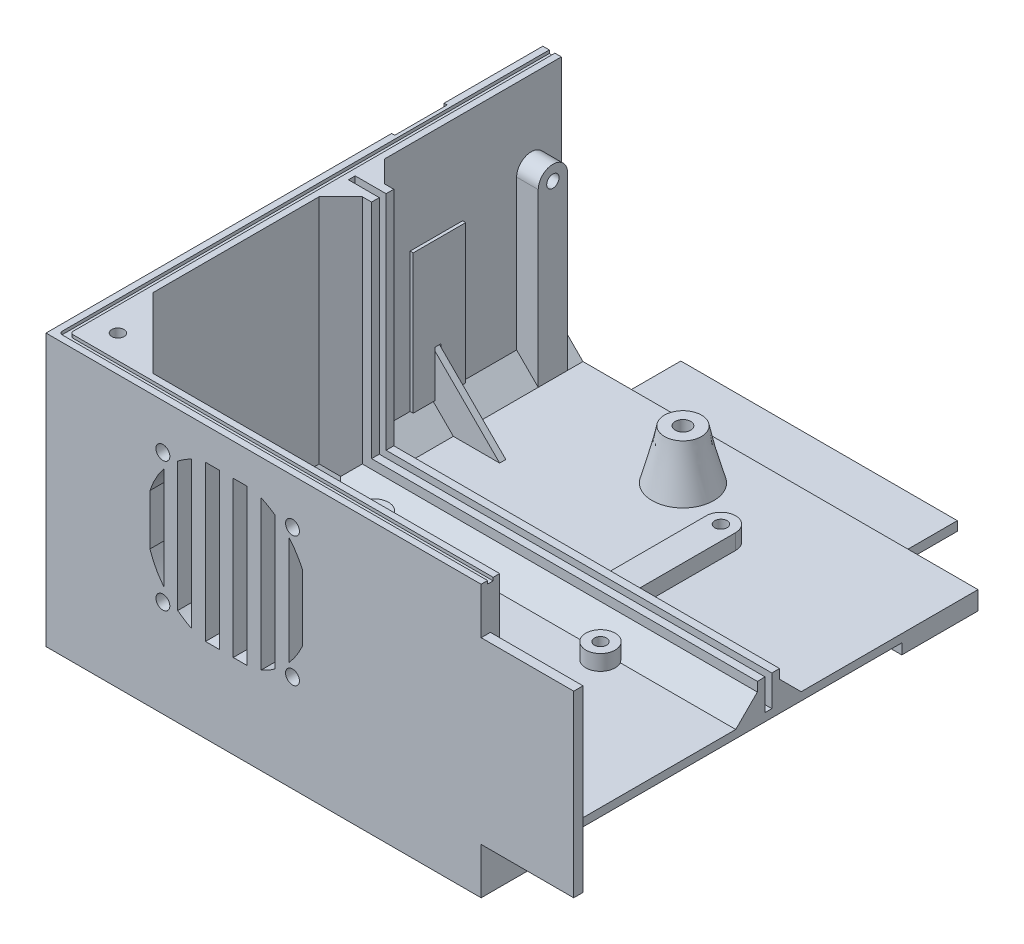
from build123d import *

# Parameters (mm, degrees)
SKETCH2_W            = 141
SKETCH2_H            = 161
BOSS_EXTRUDE1_DEPTH  = 88
SKETCH3_W            = 135
SKETCH3_H            = 155
CUT_EXTRUDE1_DEPTH   = 82
SKETCH4_W            = 41
SKETCH4_H            = 111.6
CUT_EXTRUDE2_DEPTH   = 3.4
SKETCH5_W            = 89.6
SKETCH5_H            = 19
BOSS_EXTRUDE2_DEPTH  = 3
SKETCH6_W            = 30
SKETCH6_H            = 58
BOSS_EXTRUDE3_DEPTH  = 3
SKETCH7_W            = 9.4
SKETCH7_H            = 68.6
CUT_EXTRUDE3_DEPTH   = 3.4
SKETCH8_W            = 4.5
SKETCH8_H            = 25.15
SKETCH8_R            = 2.25
CUT_EXTRUDE4_DEPTH   = 246
SKETCH9_W            = 2.5
SKETCH9_H            = 82
BOSS_EXTRUDE4_DEPTH  = 10
SKETCH10_W           = 125
SKETCH10_H           = 2.5
BOSS_EXTRUDE5_DEPTH  = 10
BOSS_EXTRUDE6_DEPTH  = 9
SKETCH12_R           = 2
CUT_EXTRUDE5_DEPTH   = 5
BOSS_EXTRUDE7_DEPTH  = 73
BOSS_EXTRUDE8_DEPTH  = 5
SKETCH16_R           = 2
CUT_EXTRUDE7_DEPTH   = 5
BOSS_EXTRUDE10_DEPTH = 82
SKETCH18_R           = 4.75
SKETCH18_R_2         = 2
BOSS_EXTRUDE11_DEPTH = 5
BOSS_EXTRUDE12_REACH = 233.4
BOSS_EXTRUDE13_REACH = 233.4
BOSS_EXTRUDE14_REACH = 233.4
BOSS_EXTRUDE15_REACH = 247
BOSS_EXTRUDE16_REACH = 233.4
SKETCH30_R           = 4.75
BOSS_EXTRUDE18_DEPTH = 7
SKETCH31_R           = 2
CUT_EXTRUDE11_DEPTH  = 5
SKETCH34_R           = 2.5
CUT_EXTRUDE13_DEPTH  = 6
CUT_EXTRUDE14_DEPTH  = 1
SKETCH38_W           = 17
SKETCH38_H           = 88
CUT_EXTRUDE15_DEPTH  = 1
BOSS_EXTRUDE21_DEPTH = 2
BOSS_EXTRUDE22_START = -7
BOSS_EXTRUDE22_DEPTH = 7
FILLET1_R            = 1
SKETCH44_R           = 2
CUT_EXTRUDE16_DEPTH  = 5
BOSS_EXTRUDE23_DEPTH = 1


with BuildPart() as part:
    # Sketch2 → Boss-Extrude1 (new body)
    with BuildSketch(Plane(origin=(0, 0, 0), x_dir=(1, 0, 0), z_dir=(0, 1, 0))):
        with Locations((-70.5, -80.5)):
            Rectangle(SKETCH2_W, SKETCH2_H)
    extrude(amount=BOSS_EXTRUDE1_DEPTH)

    # Sketch3 → Cut-Extrude1 (cut)
    with BuildSketch(Plane(origin=(0, 88, 0), x_dir=(1, 0, 0), z_dir=(0, 1, 0))):
        with Locations((-67.5, -77.5)):
            Rectangle(SKETCH3_W, SKETCH3_H)
    extrude(amount=-CUT_EXTRUDE1_DEPTH, mode=Mode.SUBTRACT)

    # Sketch4 → Cut-Extrude2 (cut)
    with BuildSketch(Plane.XZ):
        with Locations((-20.5, 80.5)):
            Rectangle(SKETCH4_W, SKETCH4_H)
    extrude(amount=-CUT_EXTRUDE2_DEPTH, mode=Mode.SUBTRACT)

    # Sketch5 → Boss-Extrude2 (add)
    with BuildSketch(Plane.XZ):
        with Locations((-70.5, -9.5)):
            Rectangle(SKETCH5_W, SKETCH5_H)
    extrude(amount=-BOSS_EXTRUDE2_DEPTH)

    # Sketch6 → Boss-Extrude3 (add)
    with BuildSketch(Plane.XY.offset(161)):
        with Locations((15, 44)):
            Rectangle(SKETCH6_W, SKETCH6_H)
    extrude(amount=-BOSS_EXTRUDE3_DEPTH)

    # Sketch7 → Cut-Extrude3 (cut)
    with BuildSketch(Plane.ZY.offset(141)):
        with Locations((4.7, 44)):
            Rectangle(SKETCH7_W, SKETCH7_H)
    extrude(amount=-CUT_EXTRUDE3_DEPTH, mode=Mode.SUBTRACT)

    # Sketch8 → Cut-Extrude4 (cut, through all)
    with BuildSketch(Plane.XY.offset(161)):
        with BuildLine():
            Line((-107.324594335, 60.631643619), (-107.324594335, 52.433473091))
            Line((-107.324594335, 52.433473091), (-102.824594335, 52.433473091))
            Line((-102.824594335, 52.433473091), (-102.824594335, 68.979167395))
            ThreePointArc((-102.824594335, 68.979167395), (-105.451034018, 65.008337373), (-107.324594335, 60.631643619))
        make_face()
        with BuildLine():
            Line((-102.824594335, 52.433473091), (-107.324594335, 52.433473091))
            Line((-107.324594335, 52.433473091), (-107.324594335, 44.235302564))
            ThreePointArc((-107.324594335, 44.235302564), (-105.451034018, 39.85860881), (-102.824594335, 35.887778787))
            Line((-102.824594335, 35.887778787), (-102.824594335, 52.433473091))
        make_face()
        with BuildLine():
            Line((-93.824594335, 52.433473091), (-98.324594335, 52.433473091))
            Line((-98.324594335, 52.433473091), (-98.324594335, 31.461825564))
            ThreePointArc((-98.324594335, 31.461825564), (-96.144951734, 29.946152699), (-93.824594335, 28.656172992))
            Line((-93.824594335, 28.656172992), (-93.824594335, 52.433473091))
        make_face()
        with BuildLine():
            Line((-98.324594335, 73.405120618), (-98.324594335, 52.433473091))
            Line((-98.324594335, 52.433473091), (-93.824594335, 52.433473091))
            Line((-93.824594335, 52.433473091), (-93.824594335, 76.21077319))
            ThreePointArc((-93.824594335, 76.21077319), (-96.144951734, 74.920793483), (-98.324594335, 73.405120618))
        make_face()
        with Locations((-87.074594335, 65.008473091)):
            Rectangle(SKETCH8_W, SKETCH8_H)
        with Locations((-87.074594335, 39.858473091)):
            Rectangle(SKETCH8_W, SKETCH8_H)
        with Locations((-78.074594335, 39.858473091)):
            Rectangle(SKETCH8_W, SKETCH8_H)
        with Locations((-78.074594335, 65.008473091)):
            Rectangle(SKETCH8_W, SKETCH8_H)
        with BuildLine():
            Line((-71.324594335, 76.632853249), (-71.324594335, 52.433473091))
            Line((-71.324594335, 52.433473091), (-66.824594335, 52.433473091))
            Line((-66.824594335, 52.433473091), (-66.824594335, 74.070478429))
            ThreePointArc((-66.824594335, 74.070478429), (-69.011854683, 75.461848171), (-71.324594335, 76.632853249))
        make_face()
        with BuildLine():
            Line((-66.824594335, 52.433473091), (-71.324594335, 52.433473091))
            Line((-71.324594335, 52.433473091), (-71.324594335, 28.234092934))
            ThreePointArc((-71.324594335, 28.234092934), (-69.011854683, 29.405098011), (-66.824594335, 30.796467753))
            Line((-66.824594335, 30.796467753), (-66.824594335, 52.433473091))
        make_face()
        with BuildLine():
            Line((-57.824594335, 52.433473091), (-62.324594335, 52.433473091))
            Line((-62.324594335, 52.433473091), (-62.324594335, 34.82069364))
            ThreePointArc((-62.324594335, 34.82069364), (-59.795312215, 38.162763227), (-57.824594335, 41.861812862))
            Line((-57.824594335, 41.861812862), (-57.824594335, 52.433473091))
        make_face()
        with BuildLine():
            Line((-62.324594335, 70.046252543), (-62.324594335, 52.433473091))
            Line((-62.324594335, 52.433473091), (-57.824594335, 52.433473091))
            Line((-57.824594335, 52.433473091), (-57.824594335, 63.00513332))
            ThreePointArc((-57.824594335, 63.00513332), (-59.795312215, 66.704182955), (-62.324594335, 70.046252543))
        make_face()
        with Locations((-103.124594335, 73.433473091)):
            Circle(SKETCH8_R)
        with Locations((-103.124594335, 31.433473091)):
            Circle(SKETCH8_R)
        with Locations((-61.124594335, 31.433473091)):
            Circle(SKETCH8_R)
        with Locations((-61.124594335, 73.433473091)):
            Circle(SKETCH8_R)
    extrude(amount=-CUT_EXTRUDE4_DEPTH, mode=Mode.SUBTRACT)

    # Sketch9 → Boss-Extrude4 (add)
    with BuildSketch(Plane(origin=(-135, 0, 0), x_dir=(0, 0, -1), z_dir=(1, 0, 0))):
        with Locations((-70.25, 47)):
            Rectangle(SKETCH9_W, SKETCH9_H)
        with Locations((-65.55, 47)):
            Rectangle(SKETCH9_W, SKETCH9_H)
    extrude(amount=BOSS_EXTRUDE4_DEPTH)

    # Sketch10 → Boss-Extrude5 (add)
    with BuildSketch(Plane(origin=(0, 6, 0), x_dir=(1, 0, 0), z_dir=(0, 1, 0))):
        with Locations((-62.5, -70.25)):
            Rectangle(SKETCH10_W, SKETCH10_H)
        with Locations((-62.5, -65.55)):
            Rectangle(SKETCH10_W, SKETCH10_H)
    extrude(amount=BOSS_EXTRUDE5_DEPTH)

    # Sketch11 → Boss-Extrude6 (add)
    with BuildSketch(Plane(origin=(0, 88, 0), x_dir=(1, 0, 0), z_dir=(0, 1, 0))):
        Polygon((-135, -155), (-135, -132.372583002), (-112.372583002, -155), align=None)
    extrude(amount=-BOSS_EXTRUDE6_DEPTH)

    # Sketch12 → Cut-Extrude5 (cut)
    with BuildSketch(Plane(origin=(0, 88, 0), x_dir=(1, 0, 0), z_dir=(0, 1, 0))):
        with Locations(Location((-129.343145751, -149.343145751, 0), (0, 0, 270))):
            Circle(SKETCH12_R)
    extrude(amount=-CUT_EXTRUDE5_DEPTH, mode=Mode.SUBTRACT)

    # Sketch13 → Boss-Extrude7 (add)
    with BuildSketch(Plane(origin=(0, 6, 0), x_dir=(1, 0, 0), z_dir=(0, 1, 0))):
        Polygon((-135, -155), (-128, -155), (-135, -148), align=None)
    extrude(amount=BOSS_EXTRUDE7_DEPTH)

    # Sketch14 → Boss-Extrude8 (add)
    with BuildSketch(Plane(origin=(0, 6, 0), x_dir=(1, 0, 0), z_dir=(0, 1, 0))):
        with BuildLine():
            Line((-59.75, -28.3), (-59.75, -64.3))
            Line((-59.75, -64.3), (-50.25, -64.3))
            Line((-50.25, -64.3), (-50.25, -28.3))
            ThreePointArc((-50.25, -28.3), (-55, -23.55), (-59.75, -28.3))
        make_face()
    extrude(amount=BOSS_EXTRUDE8_DEPTH)

    # Sketch16 → Cut-Extrude7 (cut)
    with BuildSketch(Plane(origin=(0, 11, 0), x_dir=(1, 0, 0), z_dir=(0, 1, 0))):
        with Locations(Location((-55, -28.3, 0), (0, 0, 270))):
            Circle(SKETCH16_R)
    extrude(amount=-CUT_EXTRUDE7_DEPTH, mode=Mode.SUBTRACT)

    # Sketch17 → Boss-Extrude10 (add)
    with BuildSketch(Plane(origin=(0, 6, 0), x_dir=(1, 0, 0), z_dir=(0, 1, 0))):
        Polygon((-135, -71.5), (-135, -78.5), (-128, -71.5), align=None)
        Polygon((-135, -64.3), (-135, -57.3), (-128, -64.3), align=None)
    extrude(amount=BOSS_EXTRUDE10_DEPTH)

    # Sketch18 → Boss-Extrude11 (add)
    # profile 1 of 5: a face of its own
    with BuildSketch(Plane(origin=(0, 6, 0), x_dir=(1, 0, 0), z_dir=(0, 1, 0))):
        with Locations(Location((-115, -80.755, 0), (0, 0, 90))):
            Circle(SKETCH18_R)
        with Locations(Location((-115, -80.755, 0), (0, 0, 270))):
            Circle(SKETCH18_R_2, mode=Mode.SUBTRACT)
    # profile 2 of 5: a face of its own
    with BuildSketch(Plane(origin=(0, 6, 0), x_dir=(1, 0, 0), z_dir=(0, 1, 0))):
        with Locations(Location((-41.57, -80.755, 0), (0, 0, 90))):
            Circle(SKETCH18_R)
        with Locations(Location((-41.57, -80.755, 0), (0, 0, 270))):
            Circle(SKETCH18_R_2, mode=Mode.SUBTRACT)
    # profile 3 of 5: a face of its own
    with BuildSketch(Plane(origin=(0, 6, 0), x_dir=(1, 0, 0), z_dir=(0, 1, 0))):
        with Locations(Location((-115, -141.745, 0), (0, 0, 90))):
            Circle(SKETCH18_R)
        with Locations(Location((-115, -141.745, 0), (0, 0, 270))):
            Circle(SKETCH18_R_2, mode=Mode.SUBTRACT)
    # profile 4 of 5: a face of its own
    with BuildSketch(Plane(origin=(0, 6, 0), x_dir=(1, 0, 0), z_dir=(0, 1, 0))):
        with Locations(Location((-41.57, -141.745, 0), (0, 0, 90))):
            Circle(SKETCH18_R)
        with Locations(Location((-41.57, -141.745, 0), (0, 0, 270))):
            Circle(SKETCH18_R_2, mode=Mode.SUBTRACT)
    # profile 5 of 5: a face of its own
    with BuildSketch(Plane(origin=(0, 6, 0), x_dir=(1, 0, 0), z_dir=(0, 1, 0))):
        with Locations(Location((-115, -111.125, 0), (0, 0, 90))):
            Circle(SKETCH18_R)
        with Locations(Location((-115, -111.125, 0), (0, 0, 270))):
            Circle(SKETCH18_R_2, mode=Mode.SUBTRACT)
    extrude(amount=BOSS_EXTRUDE11_DEPTH)

    # Boss-Extrude12: up to this face of the body (flat: up to its plane)
    boss_extrude12_end = Plane(part.part.faces().sort_by_distance((-135, 46.076415935, 112.568412888))[0])
    # Sketch20 → Boss-Extrude12 (add, up to the picked face)
    with BuildSketch(Plane(origin=(0, 0, 0), x_dir=(0, 0, -1), z_dir=(1, 0, 0)), mode=Mode.PRIVATE) as boss_extrude12_sk1:
        Polygon((-71.5, 6), (-78.5, 6), (-71.5, 13), align=None)
    boss_extrude12_tool1 = split(extrude(boss_extrude12_sk1.sketch, amount=-BOSS_EXTRUDE12_REACH, mode=Mode.PRIVATE), bisect_by=boss_extrude12_end, keep=Keep.BOTH, mode=Mode.PRIVATE)
    add(boss_extrude12_tool1.solids().sort_by(Axis((0, 8.333333, 73.833333), (-1, 0, 0)))[0])

    # Boss-Extrude13: up to this plane
    boss_extrude13_end = Plane(origin=(-135, 97.899494937, 57.3), z_dir=(-0.7071067811865478, 0, 0.7071067811865472))
    # Sketch21 → Boss-Extrude13 (add, up to the surface)
    with BuildSketch(Plane(origin=(0, 0, 0), x_dir=(0, 0, -1), z_dir=(1, 0, 0)), mode=Mode.PRIVATE) as boss_extrude13_sk1:
        Polygon((-64.3, 6), (-64.3, 13), (-57.3, 6), align=None)
    boss_extrude13_tool1 = split(extrude(boss_extrude13_sk1.sketch, amount=-BOSS_EXTRUDE13_REACH, mode=Mode.PRIVATE), bisect_by=boss_extrude13_end, keep=Keep.BOTH, mode=Mode.PRIVATE)
    add(boss_extrude13_tool1.solids().sort_by_distance((0, 8.333333, 61.966667))[0])

    # Boss-Extrude14: up to this plane
    boss_extrude14_end = Plane(origin=(-128, 88.899494937, 155), z_dir=(-0.7071067811865476, 0, 0.7071067811865476))
    # Sketch22 → Boss-Extrude14 (add, up to the surface)
    with BuildSketch(Plane(origin=(0, 0, 0), x_dir=(0, 0, -1), z_dir=(1, 0, 0)), mode=Mode.PRIVATE) as boss_extrude14_sk1:
        Polygon((-155, 6), (-155, 13), (-148, 6), align=None)
    boss_extrude14_tool1 = split(extrude(boss_extrude14_sk1.sketch, amount=-BOSS_EXTRUDE14_REACH, mode=Mode.PRIVATE), bisect_by=boss_extrude14_end, keep=Keep.BOTH, mode=Mode.PRIVATE)
    add(boss_extrude14_tool1.solids().sort_by_distance((0, 8.333333, 152.666667))[0])

    # Boss-Extrude15: up to this plane
    boss_extrude15_end = Plane(origin=(-135, 97.899494937, 78.5), z_dir=(-0.7071067811865476, 0, -0.7071067811865476))
    # Sketch23 → Boss-Extrude15 (add, up to the surface)
    with BuildSketch(Plane.XY.offset(161), mode=Mode.PRIVATE) as boss_extrude15_sk1:
        Polygon((-135, 6), (-135, 13), (-128, 6), align=None)
    boss_extrude15_tool1 = split(extrude(boss_extrude15_sk1.sketch, amount=-BOSS_EXTRUDE15_REACH, mode=Mode.PRIVATE), bisect_by=boss_extrude15_end, keep=Keep.BOTH, mode=Mode.PRIVATE)
    add(boss_extrude15_tool1.solids().sort_by_distance((-132.666667, 8.333333, 161))[0])

    # Boss-Extrude16: up to this plane
    boss_extrude16_end = Plane(origin=(-135, 97.899494937, 57.3), z_dir=(-0.7071067811865478, 0, 0.7071067811865472))
    # Sketch24 → Boss-Extrude16 (add, up to the surface)
    with BuildSketch(Plane(origin=(0, 0, 0), x_dir=(-1, 0, 0), z_dir=(0, 0, -1)), mode=Mode.PRIVATE) as boss_extrude16_sk1:
        Polygon((135, 6), (128, 6), (135, 13), align=None)
    boss_extrude16_tool1 = split(extrude(boss_extrude16_sk1.sketch, amount=-BOSS_EXTRUDE16_REACH, mode=Mode.PRIVATE), bisect_by=boss_extrude16_end, keep=Keep.BOTH, mode=Mode.PRIVATE)
    add(boss_extrude16_tool1.solids().sort_by_distance((-132.666667, 8.333333, 0))[0])

    # Loft1: read off the stored shape, not the designer's step
    # Loft1: loft between two sections, ruled curve by curve
    loft1_from = [
        Edge.make_bspline([(-83.475173005, 22, 19.687686999), (-87.190547002, 22, 8.277340989), (-75.780200992, 22, 4.561966992), (-72.064826995, 22, 15.972313001), (-68.349452998, 22, 27.382659011), (-79.759799008, 22, 31.098033008), (-83.475173005, 22, 19.687686999)], [0, 0, 0, 0, 0.5, 0.5, 0.5, 1, 1, 1, 1], 3, [1, 0.333333333, 0.333333333, 1, 0.333333333, 0.333333333, 1]),
    ]
    loft1_to = [
        Edge.make_bspline([(-85.055383699, 6, 24.680049953), (-98.755483605, 6, 10.109282554), (-84.184716206, 6, -3.590817351), (-70.484616301, 6, 10.979950047), (-56.784516395, 6, 25.550717446), (-71.355283794, 6, 39.250817351), (-85.055383699, 6, 24.680049953)], [0, 0, 0, 0, 0.5, 0.5, 0.5, 1, 1, 1, 1], 3, [1, 0.333333333, 0.333333333, 1, 0.333333333, 0.333333333, 1]),
    ]
    loft1 = Solid(Shell([*[Face.make_surface_from_curves(loft1_from[k], loft1_to[k]) for k in range(1)], Face(Wire(loft1_from)), Face(Wire(loft1_to))]))
    add(loft1)

    # Sketch30 → Boss-Extrude18 (add)
    with BuildSketch(Plane(origin=(-135, 0, 0), x_dir=(0, 0, -1), z_dir=(1, 0, 0))):
        with Locations(Location((-9.75, 61.5, 0), (0, 0, 180))):
            Circle(SKETCH30_R)
    extrude(amount=BOSS_EXTRUDE18_DEPTH)

    # Sketch31 → Cut-Extrude11 (cut)
    with BuildSketch(Plane(origin=(-128, 0, 0), x_dir=(0, 0, -1), z_dir=(1, 0, 0))):
        with Locations((-9.75, 61.5)):
            Circle(SKETCH31_R)
    extrude(amount=-CUT_EXTRUDE11_DEPTH, mode=Mode.SUBTRACT)

    # Sketch34 → Cut-Extrude13 (cut)
    with BuildSketch(Plane(origin=(0, 22, 0), x_dir=(1, 0, 0), z_dir=(0, 1, 0))):
        with Locations(Location((-77.77, -17.83, 0), (0, 0, 270))):
            Circle(SKETCH34_R)
    extrude(amount=-CUT_EXTRUDE13_DEPTH, mode=Mode.SUBTRACT)

    # Sketch36 → Cut-Extrude14 (cut)
    with BuildSketch(Plane(origin=(0, 88, 0), x_dir=(1, 0, 0), z_dir=(0, 1, 0))):
        Polygon((-138.9, 0), (-138.9, -158.9), (0, -158.9), (0, -157.1), (-137.1, -157.1), (-137.1, 0), align=None)
    extrude(amount=-CUT_EXTRUDE14_DEPTH, mode=Mode.SUBTRACT)

    # Sketch38 → Cut-Extrude15 (cut)
    with BuildSketch(Plane.ZY.offset(141)):
        with Locations((40.5, 44)):
            Rectangle(SKETCH38_W, SKETCH38_H)
    extrude(amount=-CUT_EXTRUDE15_DEPTH, mode=Mode.SUBTRACT)

    # Sketch42 → Boss-Extrude21 (add)
    with BuildSketch(Plane.XY.offset(40)):
        Polygon((-135, 28), (-135, 13), (-128, 6), (-113, 6), align=None)
    extrude(amount=BOSS_EXTRUDE21_DEPTH)

    # Sketch43 → Boss-Extrude22 (add)
    with BuildSketch(Plane(origin=(-128, 0, 0), x_dir=(0, 0, -1), z_dir=(1, 0, 0)).offset(BOSS_EXTRUDE22_START)):
        with BuildLine():
            Line((-5, 6), (-5, 61.5))
            ThreePointArc((-5, 61.5), (-9.75, 56.75), (-14.5, 61.5))
            Line((-14.5, 61.5), (-14.5, 6))
            Line((-14.5, 6), (-5, 6))
        make_face()
    extrude(amount=BOSS_EXTRUDE22_DEPTH)

    # Fillet1
    fillet1_edges = [part.edges().sort_by_distance(p)[0] for p in [
        (-137.1, 87.5, 157.1),
        (-138.9, 87.5, 158.9),
    ]]
    fillet(fillet1_edges, radius=FILLET1_R)

    # Sketch44 → Cut-Extrude16 (cut)
    with BuildSketch(Plane.ZY.offset(140)):
        with Locations((40.5, 48)):
            Circle(SKETCH44_R)
    extrude(amount=-CUT_EXTRUDE16_DEPTH, mode=Mode.SUBTRACT)

    # Sketch45 → Boss-Extrude23 (add)
    with BuildSketch(Plane(origin=(-135, 0, 0), x_dir=(0, 0, -1), z_dir=(1, 0, 0))):
        Polygon((-32, 58), (-32, 13), (-40, 13), (-40, 28), (-42, 28), (-42, 13), (-49, 13), (-49, 58), align=None)
    extrude(amount=BOSS_EXTRUDE23_DEPTH)


solid = part.part
